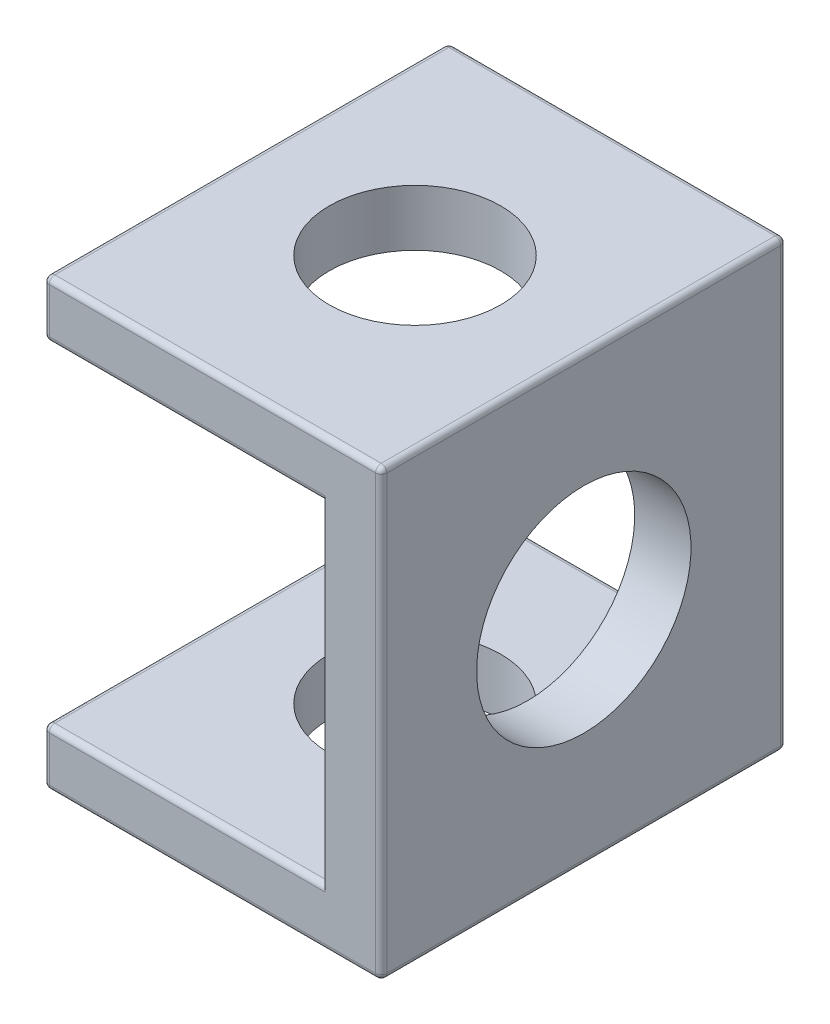
from build123d import *

# Parameters (mm, degrees)
EXTRUDE_THIN1_DEPTH = 72
SKETCH2_R           = 15.24
CUT_EXTRUDE2_DEPTH  = 10
CUT_EXTRUDE3_START  = -10
SKETCH3_R           = 15.24
CUT_EXTRUDE3_DEPTH  = 10
SKETCH6_R           = 19.05
CUT_EXTRUDE4_DEPTH  = 10
FILLET2_R           = 1
FILLET3_R           = 1
FILLET4_R           = 1
FILLET5_R           = 1
FILLET6_R           = 1
FILLET7_R           = 1
FILLET8_R           = 1
FILLET9_R           = 1


with BuildPart() as part:
    # Sketch1 → Extrude-Thin1 (new body)
    with BuildSketch(Plane.XY):
        Polygon((0, 0), (60, 0), (60, -79), (0, -79), (0, -69), (50, -69), (50, -10), (0, -10), align=None)
    extrude(amount=EXTRUDE_THIN1_DEPTH)

    # Sketch2 → Cut-Extrude2 (cut)
    with BuildSketch(Plane(origin=(0, 0, 0), x_dir=(1, 0, 0), z_dir=(0, 1, 0))):
        with Locations(Location((30, -36, 0), (0, 0, 270))):
            Circle(SKETCH2_R)
    extrude(amount=-CUT_EXTRUDE2_DEPTH, mode=Mode.SUBTRACT)

    # Sketch3 → Cut-Extrude3 (cut)
    with BuildSketch(Plane.XZ.offset(79).offset(CUT_EXTRUDE3_START)):
        with Locations(Location((30, 36, 0), (0, 0, 90))):
            Circle(SKETCH3_R)
    extrude(amount=CUT_EXTRUDE3_DEPTH, mode=Mode.SUBTRACT)

    # Sketch6 → Cut-Extrude4 (cut)
    with BuildSketch(Plane.ZY.offset(-50)):
        with Locations(Location((36, -39.5, 0), (0, 0, 270))):
            Circle(SKETCH6_R)
    extrude(amount=-CUT_EXTRUDE4_DEPTH, mode=Mode.SUBTRACT)

    # Fillet2
    fillet2_edges = [part.edges().sort_by_distance(p)[0] for p in [
        (0, 0, 36),
        (30, 0, 0),
    ]]
    fillet(fillet2_edges, radius=FILLET2_R)

    # Fillet3
    fillet3_edges = [part.edges().sort_by_distance(p)[0] for p in [
        (0, -10, 36),
    ]]
    fillet(fillet3_edges, radius=FILLET3_R)

    # Fillet4
    # the kernel refuses this fillet: 1 mm, written as the material it takes off along each edge
    with BuildSketch(Plane(origin=(1, -1, 1), x_dir=(0, 0, -1), z_dir=(-1, 0, 0))) as fillet4_piece_1_section:
        Polygon((0, 0), (FILLET4_R, 0), (FILLET4_R, -FILLET4_R), (0, -FILLET4_R), align=None)
    fillet4_piece_1 = extrude(amount=FILLET4_R, mode=Mode.PRIVATE)
    fillet4_piece_1 = fillet4_piece_1 - Plane(origin=(1, -1, 1), x_dir=(0, -0.7071067811865475, 0.7071067811865475), z_dir=(-1, 0, 0)) * Sphere(FILLET4_R, mode=Mode.PRIVATE)
    add(fillet4_piece_1, mode=Mode.SUBTRACT)
    with BuildSketch(Plane(origin=(50, -10, 0), x_dir=(0, 0, 1), z_dir=(-1, 0, 0))) as fillet4_piece_2:
        with BuildLine():
            CenterArc((FILLET4_R, FILLET4_R), FILLET4_R, 180, 90)
            Line((0, FILLET4_R), (0, 0))
            Line((0, 0), (FILLET4_R, 0))
        make_face()
    extrude(amount=49, mode=Mode.SUBTRACT)
    with BuildSketch(Plane(origin=(0, -9, 0), x_dir=(0, 0, 1), z_dir=(0, 1, 0))) as fillet4_piece_3:
        with BuildLine():
            CenterArc((FILLET4_R, FILLET4_R), FILLET4_R, 180, 90)
            Line((0, FILLET4_R), (0, 0))
            Line((0, 0), (FILLET4_R, 0))
        make_face()
    extrude(amount=8, mode=Mode.SUBTRACT)
    with BuildSketch(Plane(origin=(1, -9, 0), x_dir=(-1, 0, 0), z_dir=(0, 1, 0))) as fillet4_piece_4:
        with BuildLine():
            CenterArc((1 - FILLET4_R, FILLET4_R), FILLET4_R, 270, 90)
            Line((1 - FILLET4_R, 0), (1, 0))
            Line((1, 0), (1, FILLET4_R))
        make_face()
    revolve(axis=Axis((1, -9, 0), (0, 0, 1)), revolution_arc=90, mode=Mode.SUBTRACT)

    # Fillet5
    fillet5_edges = [part.edges().sort_by_distance(p)[0] for p in [
        (30.5, 0, 72),
        (0.292893219, -0.292893219, 72),
        (25.5, -10, 72),
        (0, -5, 72),
        (0.292893219, -9.707106781, 72),
    ]]
    fillet(fillet5_edges, radius=FILLET5_R)

    # Fillet6
    fillet6_edges = [part.edges().sort_by_distance(p)[0] for p in [
        (60, -40, 0),
        (60, -0.292893219, 0.292893219),
        (60, -40, 72),
        (60, 0, 36),
        (60, -0.292893219, 71.707106781),
    ]]
    fillet(fillet6_edges, radius=FILLET6_R)

    # Fillet7
    fillet7_edges = [part.edges().sort_by_distance(p)[0] for p in [
        (0, -69, 36),
    ]]
    fillet(fillet7_edges, radius=FILLET7_R)

    # Fillet8
    fillet8_edges = [part.edges().sort_by_distance(p)[0] for p in [
        (0, -79, 36),
    ]]
    fillet(fillet8_edges, radius=FILLET8_R)

    # Fillet9
    fillet9_edges = [part.edges().sort_by_distance(p)[0] for p in [
        (0.292893219, -69.292893219, 0),
        (0.292893219, -69.292893219, 72),
        (0, -74, 0),
        (0.292893219, -78.707106781, 0),
        (0, -74, 72),
        (0.292893219, -78.707106781, 72),
        (25.5, -69, 72),
        (60, -79, 36),
        (30, -79, 0),
        (25.5, -69, 0),
        (30, -79, 72),
        (59.707106781, -79, 0.292893219),
        (59.707106781, -79, 71.707106781),
    ]]
    fillet(fillet9_edges, radius=FILLET9_R)


solid = part.part
